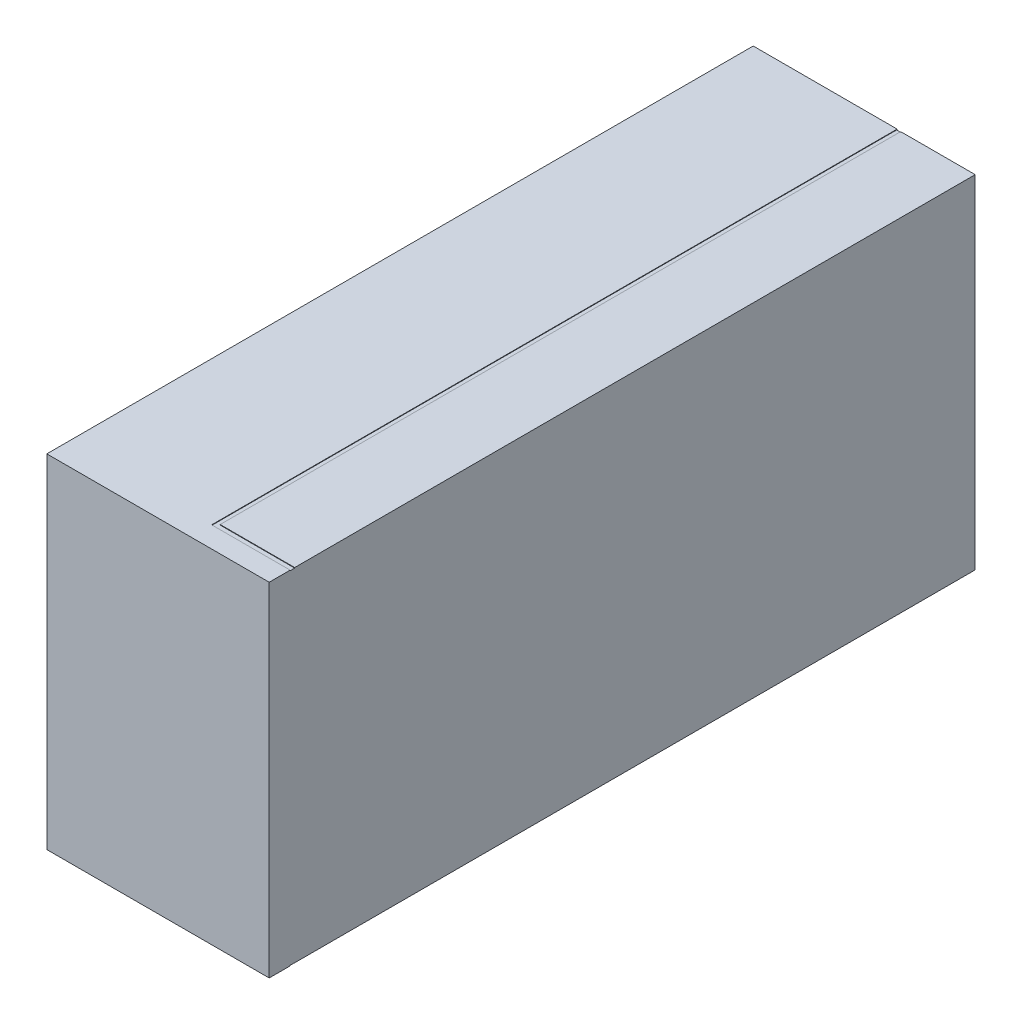
from build123d import *
from build123d.topology import SkipClean

# Parameters (mm, degrees)
SKETCH2_W               = 67.5
SKETCH2_H               = 32.75
BOSS_EXTRUDE1_DEPTH     = 21.25
CUT_EXTRUDE3_DEPTH      = 52.606080068
CUT_EXTRUDE3_DEPTH_BACK = 0.05
SKETCH4_W               = 7.5
SKETCH4_H               = 32.7
CUT_EXTRUDE6_DEPTH      = 0.05
SKETCH5_W               = 7.5
SKETCH5_H               = 65.45
CUT_EXTRUDE7_DEPTH      = 0.05
SKETCH6_W               = 7.119941604
SKETCH6_H               = 65.013736252
BOSS_EXTRUDE9_DEPTH     = 0.05
SKETCH15_W              = 6.895148233
SKETCH15_H              = 32.7
BOSS_EXTRUDE14_DEPTH    = 0.01
SKETCH16_W              = 7.139794156
SKETCH16_H              = 65.046080354
BOSS_EXTRUDE15_DEPTH    = 0.01
SKETCH18_W              = 12
SKETCH18_H              = 15
CUT_EXTRUDE14_DEPTH     = 3
CUT_EXTRUDE14_DRAFT     = -30
SKETCH19_W              = 7.508639757
SKETCH19_H              = 3.271964709
BOSS_EXTRUDE16_DEPTH    = 3
SKETCH21_R              = 2.5
CUT_EXTRUDE17_DEPTH     = 2
CUT_EXTRUDE17_DRAFT     = -35


with BuildPart() as part:
    # Sketch2 → Boss-Extrude1 (new body)
    with BuildSketch(Plane(origin=(0, 0, 0), x_dir=(0, 0, -1), z_dir=(1, 0, 0))):
        Rectangle(SKETCH2_W, SKETCH2_H)
    extrude(amount=BOSS_EXTRUDE1_DEPTH)

    # Sketch3 → Cut-Extrude3 (cut, two sides: drawn at the far end of the back side and taken through both)
    with SkipClean():  # the faces are left unmerged after this step: merging them gives an invalid solid
        with BuildSketch(Plane(origin=(0, 16.375, 0), x_dir=(1, 0, 0), z_dir=(0, 1, 0)).offset(-CUT_EXTRUDE3_DEPTH_BACK)):
            with BuildLine():
                Line((-134.022457335, 33.75), (13.75, 33.75))
                Line((13.75, 33.75), (13.751, 33.75))
                Line((13.75, 33.75), (13.75, -31.747079321))
                Line((13.75, -31.747079321), (21.25, -31.747079321))
                Line((21.25, -31.747079321), (169.022457335, -31.747079321))
                Line((169.022457335, -31.747079321), (231.45697941, 257.127853894))
                Line((231.45697941, 257.127853894), (-71.58793526, 322.624933215))
                Line((-71.58793526, 322.624933215), (-134.022457335, 33.75))
            make_face()
        extrude(amount=CUT_EXTRUDE3_DEPTH + CUT_EXTRUDE3_DEPTH_BACK, mode=Mode.SUBTRACT)
    add(part.part.scale(1), mode=Mode.REPLACE)  # the faces are merged on a copy

    # Sketch4 → Cut-Extrude6 (cut)
    with BuildSketch(Plane(origin=(0, 0, -33.75), x_dir=(-1, 0, 0), z_dir=(0, 0, -1))):
        with Locations((-17.5, -0.025)):
            Rectangle(SKETCH4_W, SKETCH4_H)
    extrude(amount=-CUT_EXTRUDE6_DEPTH, mode=Mode.SUBTRACT)

    # Sketch5 → Cut-Extrude7 (cut)
    with BuildSketch(Plane(origin=(0, -16.375, 0), x_dir=(-1, 0, 0), z_dir=(0, -1, 0))):
        with Locations((-17.5, 0.975)):
            Rectangle(SKETCH5_W, SKETCH5_H)
    extrude(amount=-CUT_EXTRUDE7_DEPTH, mode=Mode.SUBTRACT)

    # Sketch6 → Boss-Extrude9 (add)
    with BuildSketch(Plane(origin=(0, 16.325, 0), x_dir=(1, 0, 0), z_dir=(0, 1, 0))):
        with Locations((17.690029198, 1.193131874)):
            Rectangle(SKETCH6_W, SKETCH6_H)
    extrude(amount=BOSS_EXTRUDE9_DEPTH)

    # Sketch15 → Boss-Extrude14 (add)
    with BuildSketch(Plane(origin=(0, 0, -33.7), x_dir=(-1, 0, 0), z_dir=(0, 0, -1))):
        with Locations((-17.802425883, 0.025)):
            Rectangle(SKETCH15_W, SKETCH15_H)
    extrude(amount=BOSS_EXTRUDE14_DEPTH)

    # Sketch16 → Boss-Extrude15 (add)
    with BuildSketch(Plane(origin=(0, -16.325, 0), x_dir=(-1, 0, 0), z_dir=(0, -1, 0))):
        with Locations((-17.680102922, 1.186959823)):
            Rectangle(SKETCH16_W, SKETCH16_H)
    extrude(amount=BOSS_EXTRUDE15_DEPTH)


with BuildPart() as cut_extrude14_tool:
    # Sketch18 → Cut-Extrude14 (with draft: the straight prism first)
    with BuildSketch(Plane.ZY):
        with Locations((-26.267087013, 5.422853248)):
            Rectangle(SKETCH18_W, SKETCH18_H)
    extrude(amount=-CUT_EXTRUDE14_DEPTH)
    # Cut-Extrude14: the draft: its side faces are tilted about the plane it starts from
    cut_extrude14_sides = [cut_extrude14_tool.faces().sort_by_distance(p)[0] for p in [
        (1.5, 5.422853248, -32.267087013),
        (1.5, -2.077146752, -26.267087013),
        (1.5, 5.422853248, -20.267087013),
        (1.5, 12.922853248, -26.267087013),
    ]]
    draft(cut_extrude14_sides, Plane.ZY, CUT_EXTRUDE14_DRAFT)


with BuildPart() as part_1:
    add(part.part)

    # Cut-Extrude14: cut by cut_extrude14_tool
    add(cut_extrude14_tool.part, mode=Mode.SUBTRACT)

    # Sketch19 → Boss-Extrude16 (add)
    with BuildSketch(Plane.ZY.offset(-3)):
        with Locations((-26.237986877, 8.548870353)):
            Rectangle(SKETCH19_W, SKETCH19_H)
    extrude(amount=BOSS_EXTRUDE16_DEPTH)


with BuildPart() as cut_extrude17_tool:
    # Sketch21 → Cut-Extrude17 (with draft: the straight prism first)
    with BuildSketch(Plane(origin=(0, 0, -33.75), x_dir=(-1, 0, 0), z_dir=(0, 0, -1))):
        with Locations((-10.25, -10.875)):
            Circle(SKETCH21_R)
    extrude(amount=-CUT_EXTRUDE17_DEPTH)
    # Cut-Extrude17: the draft: its side faces are tilted about the plane it starts from
    cut_extrude17_sides = [cut_extrude17_tool.faces().sort_by_distance(p)[0] for p in [
        (12.75, -10.875, -32.75),
    ]]
    draft(cut_extrude17_sides, Plane(origin=(0, 0, -33.75), x_dir=(-1, 0, 0), z_dir=(0, 0, -1)), CUT_EXTRUDE17_DRAFT)


with BuildPart() as part_2:
    add(part_1.part)

    # Cut-Extrude17: cut by cut_extrude17_tool
    add(cut_extrude17_tool.part, mode=Mode.SUBTRACT)


solid = part_2.part
